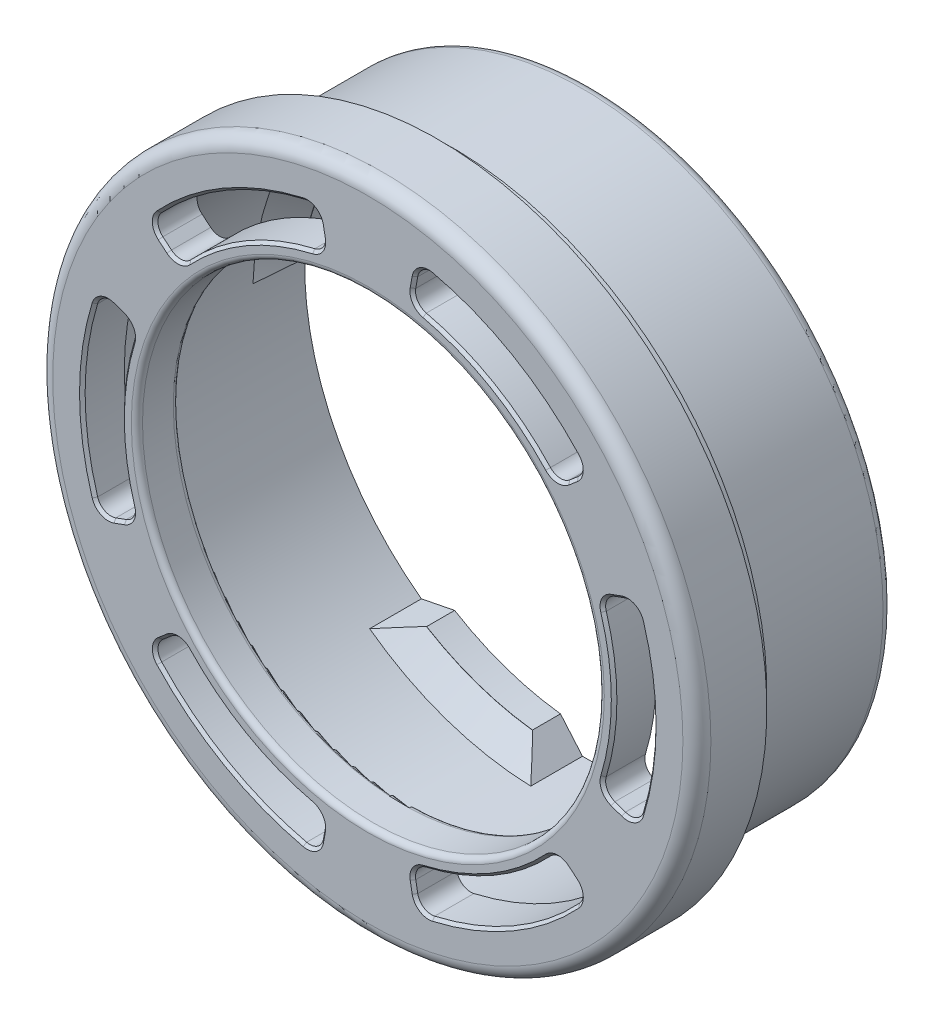
from build123d import *

# Parameters (mm, degrees)
SKETCH_1_R          = 23.515666667
SKETCH_1_R_2        = 16.5
EXTRUDE_1_DEPTH     = 6
SKETCH_2_R          = 23.515666667
SKETCH_2_R_2        = 22.515666667
CUT_EXTRUDE_3_DEPTH = 1
SKETCH_5_R          = 21.515666667
SKETCH_5_R_2        = 20.515666667
EXTRUDE_2_DEPTH     = 10
EXTRUDE_3_DEPTH     = 2
CUT_EXTRUDE_START   = -3
SKETCH_7_R          = 20.515666667
CUT_EXTRUDE_4_DEPTH = 3
CUT_EXTRUDE_5_DEPTH = 3
FILLET_1_R          = 1
FILLET_3_R          = 0.4
FILLET_4_R          = 0.4
FILLET_5_R          = 0.7
CHAMFER_1_SIZE      = 0.2
CHAMFER_START       = -10
CHAMFER_2_DEPTH     = 2
CHAMFER_START_2     = -8
CHAMFER_2_2_DEPTH   = 1.7000001


with BuildPart() as part:
    # 草图1 → 凸台-拉伸1 (new body)
    with BuildSketch(Plane.XY):
        Circle(SKETCH_1_R)
        Circle(SKETCH_1_R_2, mode=Mode.SUBTRACT)
    extrude(amount=EXTRUDE_1_DEPTH)

    # 草图2 → 切除-拉伸3 (cut)
    with BuildSketch(Plane(origin=(0, 0, 0), x_dir=(-1, 0, 0), z_dir=(0, 0, -1))):
        Circle(SKETCH_2_R)
        Circle(SKETCH_2_R_2, mode=Mode.SUBTRACT)
    extrude(amount=-CUT_EXTRUDE_3_DEPTH, mode=Mode.SUBTRACT)

    # 草图5 → 凸台-拉伸2 (add)
    with BuildSketch(Plane(origin=(0, 0, 0), x_dir=(-1, 0, 0), z_dir=(0, 0, -1))):
        with Locations(Location((0, 0, 0), (0, 0, 180))):
            Circle(SKETCH_5_R)
        Circle(SKETCH_5_R_2, mode=Mode.SUBTRACT)
    extrude(amount=EXTRUDE_2_DEPTH)

    # 草图6 → 凸台-拉伸3 (add)
    with BuildSketch(Plane(origin=(0, 0, -10), x_dir=(-1, 0, 0), z_dir=(0, 0, -1))):
        with BuildLine():
            Line((-16.080938673, -9.738758206), (-18.353991972, -11.115339319))
            ThreePointArc((-18.353991972, -11.115339319), (-20.274508623, -7.025958268), (-21.29621173, -2.625101039))
            Line((-21.29621173, -2.625101039), (-18.658778718, -2.299994948))
            ThreePointArc((-18.658778718, -2.299994948), (-17.763608609, -6.155827256), (-16.080938673, -9.738758206))
        make_face()
        with BuildLine():
            Line((-9.738758206, 16.080938673), (-11.115339319, 18.353991972))
            ThreePointArc((-11.115339319, 18.353991972), (-7.025958268, 20.274508623), (-2.625101039, 21.29621173))
            Line((-2.625101039, 21.29621173), (-2.299994948, 18.658778718))
            ThreePointArc((-2.299994948, 18.658778718), (-6.155827256, 17.763608609), (-9.738758206, 16.080938673))
        make_face()
        with BuildLine():
            Line((16.080938673, 9.738758206), (18.353991972, 11.115339319))
            ThreePointArc((18.353991972, 11.115339319), (20.274508623, 7.025958268), (21.29621173, 2.625101039))
            Line((21.29621173, 2.625101039), (18.658778718, 2.299994948))
            ThreePointArc((18.658778718, 2.299994948), (17.763608609, 6.155827256), (16.080938673, 9.738758206))
        make_face()
        with BuildLine():
            Line((9.738758206, -16.080938673), (11.115339319, -18.353991972))
            ThreePointArc((11.115339319, -18.353991972), (7.025958268, -20.274508623), (2.625101039, -21.29621173))
            Line((2.625101039, -21.29621173), (2.299994948, -18.658778718))
            ThreePointArc((2.299994948, -18.658778718), (6.155827256, -17.763608609), (9.738758206, -16.080938673))
        make_face()
    extrude(amount=-EXTRUDE_3_DEPTH)

    # 草图7 → 切除-拉伸4 (cut)
    with BuildSketch(Plane(origin=(0, 0, 0), x_dir=(-1, 0, 0), z_dir=(0, 0, -1)).offset(CUT_EXTRUDE_START)):
        with Locations(Location((0, 0, 0), (0, 0, 187.027178997))):
            Circle(SKETCH_7_R)
    extrude(amount=CUT_EXTRUDE_4_DEPTH, mode=Mode.SUBTRACT)

    # 草图8 → 切除-拉伸5 (cut)
    with BuildSketch(Plane.XY.offset(6)):
        with BuildLine():
            Line((-14.227819147, 11.938557799), (-14.841505651, 12.453501918))
            ThreePointArc((-14.841505651, 12.453501918), (-15.196828628, 13.158103248), (-14.930610724, 13.900966276))
            ThreePointArc((-14.930610724, 13.900966276), (-10.202362304, 17.66555415), (-4.578601263, 19.879547542))
            ThreePointArc((-4.578601263, 19.879547542), (-3.804704862, 19.740583121), (-3.37049634, 19.085075904))
            Line((-3.37049634, 19.085075904), (-3.226328833, 18.297299531))
            ThreePointArc((-3.226328833, 18.297299531), (-3.373933254, 17.568644402), (-3.983648834, 17.143236041))
            ThreePointArc((-3.983648834, 17.143236041), (-8.8, 15.242047107), (-12.854653498, 12.021559111))
            ThreePointArc((-12.854653498, 12.021559111), (-13.524696429, 11.706424064), (-14.227819147, 11.938557799))
        make_face()
        with BuildLine():
            Line((-17.453003912, -6.352373922), (-18.205801852, -6.626369965))
            ThreePointArc((-18.205801852, -6.626369965), (-18.993665992, -6.581788025), (-19.503895294, -5.979805043))
            ThreePointArc((-19.503895294, -5.979805043), (-20.399999818, -0.002727859), (-19.505493819, 5.974588763))
            ThreePointArc((-19.505493819, 5.974588763), (-18.998198899, 6.575320496), (-18.213408736, 6.623602498))
            Line((-18.213408736, 6.623602498), (-17.459090631, 6.354567035))
            ThreePointArc((-17.459090631, 6.354567035), (-16.901858989, 5.862410292), (-16.838302332, 5.121676931))
            ThreePointArc((-16.838302332, 5.121676931), (-17.6, 0), (-16.838302332, -5.121676931))
            ThreePointArc((-16.838302332, -5.121676931), (-16.900408842, -5.859518654), (-17.453003912, -6.352373922))
        make_face()
        with BuildLine():
            Line((3.225184765, 18.290931721), (3.364296201, 19.079871883))
            ThreePointArc((3.364296201, 19.079871883), (3.796837364, 19.739891273), (4.573284571, 19.880771319))
            ThreePointArc((4.573284571, 19.880771319), (10.197637514, 17.668282009), (14.926892555, 13.904958779))
            ThreePointArc((14.926892555, 13.904958779), (15.193494037, 13.165262624), (14.842912396, 12.461473406))
            Line((14.842912396, 12.461473406), (14.232761798, 11.942732496))
            ThreePointArc((14.232761798, 11.942732496), (13.527925735, 11.70623411), (12.854653498, 12.021559111))
            ThreePointArc((12.854653498, 12.021559111), (8.8, 15.242047107), (3.983648834, 17.143236041))
            ThreePointArc((3.983648834, 17.143236041), (3.375712412, 17.565942718), (3.225184765, 18.290931721))
        make_face()
        with BuildLine():
            Line((17.453003912, 6.352373922), (18.205801852, 6.626369965))
            ThreePointArc((18.205801852, 6.626369965), (18.993665992, 6.581788025), (19.503895294, 5.979805043))
            ThreePointArc((19.503895294, 5.979805043), (20.399999818, 0.002727859), (19.505493819, -5.974588763))
            ThreePointArc((19.505493819, -5.974588763), (18.998198899, -6.575320496), (18.213408736, -6.623602498))
            Line((18.213408736, -6.623602498), (17.459090631, -6.354567035))
            ThreePointArc((17.459090631, -6.354567035), (16.901858989, -5.862410292), (16.838302332, -5.121676931))
            ThreePointArc((16.838302332, -5.121676931), (17.6, 0), (16.838302332, 5.121676931))
            ThreePointArc((16.838302332, 5.121676931), (16.900408842, 5.859518654), (17.453003912, 6.352373922))
        make_face()
        with BuildLine():
            Line((14.227819147, -11.938557799), (14.841505651, -12.453501918))
            ThreePointArc((14.841505651, -12.453501918), (15.196828628, -13.158103248), (14.930610724, -13.900966276))
            ThreePointArc((14.930610724, -13.900966276), (10.202362304, -17.66555415), (4.578601263, -19.879547542))
            ThreePointArc((4.578601263, -19.879547542), (3.804704862, -19.740583121), (3.37049634, -19.085075904))
            Line((3.37049634, -19.085075904), (3.226328833, -18.297299531))
            ThreePointArc((3.226328833, -18.297299531), (3.373933254, -17.568644402), (3.983648834, -17.143236041))
            ThreePointArc((3.983648834, -17.143236041), (8.8, -15.242047107), (12.854653498, -12.021559111))
            ThreePointArc((12.854653498, -12.021559111), (13.524696429, -11.706424064), (14.227819147, -11.938557799))
        make_face()
        with BuildLine():
            Line((-3.225184765, -18.290931721), (-3.364296201, -19.079871883))
            ThreePointArc((-3.364296201, -19.079871883), (-3.796837364, -19.739891273), (-4.573284571, -19.880771319))
            ThreePointArc((-4.573284571, -19.880771319), (-10.197637514, -17.668282009), (-14.926892555, -13.904958779))
            ThreePointArc((-14.926892555, -13.904958779), (-15.193494037, -13.165262624), (-14.842912396, -12.461473406))
            Line((-14.842912396, -12.461473406), (-14.232761798, -11.942732496))
            ThreePointArc((-14.232761798, -11.942732496), (-13.527925735, -11.70623411), (-12.854653498, -12.021559111))
            ThreePointArc((-12.854653498, -12.021559111), (-8.8, -15.242047107), (-3.983648834, -17.143236041))
            ThreePointArc((-3.983648834, -17.143236041), (-3.375712412, -17.565942718), (-3.225184765, -18.290931721))
        make_face()
    extrude(amount=-CUT_EXTRUDE_5_DEPTH, mode=Mode.SUBTRACT)

    # 圆角1
    fillet_1_edges = [part.edges().sort_by_distance(p)[0] for p in [
        (-23.515666667, 0, 6),
    ]]
    fillet(fillet_1_edges, radius=FILLET_1_R)

    # 圆角3
    fillet_3_edges = [part.edges().sort_by_distance(p)[0] for p in [
        (-16.5, 0, 3),
    ]]
    fillet(fillet_3_edges, radius=FILLET_3_R)

    # 圆角4
    fillet_4_edges = [part.edges().sort_by_distance(p)[0] for p in [
        (-16.5, 0, 6),
    ]]
    fillet(fillet_4_edges, radius=FILLET_4_R)

    # 圆角5
    fillet_5_edges = [part.edges().sort_by_distance(p)[0] for p in [
        (-21.515666667, 0, -10),
    ]]
    fillet(fillet_5_edges, radius=FILLET_5_R)

    # 倒角1
    chamfer_1_edges = [part.edges().sort_by_distance(p)[0] for p in [
        (-16.900408842, -5.859518654, 6),
        (-17.6, 0, 6),
        (-16.901858989, 5.862410292, 6),
        (-17.836249684, 6.489084766, 6),
        (-18.998198899, 6.575320496, 6),
        (-20.399999818, -0.002727859, 6),
        (-18.993665992, -6.581788025, 6),
        (-17.829402882, -6.489371944, 6),
        (-3.375712412, -17.565942718, 6),
        (-8.8, -15.242047107, 6),
        (-13.527925735, -11.70623411, 6),
        (-14.537837097, -12.202102951, 6),
        (-15.193494037, -13.165262624, 6),
        (-10.197637514, -17.668282009, 6),
        (-3.796837364, -19.739891273, 6),
        (-3.294740483, -18.685401802, 6),
        (13.524696429, -11.706424064, 6),
        (8.8, -15.242047107, 6),
        (3.373933254, -17.568644402, 6),
        (3.298412587, -18.691187717, 6),
        (3.804704862, -19.740583121, 6),
        (10.202362304, -17.66555415, 6),
        (15.196828628, -13.158103248, 6),
        (14.534662399, -12.196029858, 6),
        (16.900408842, 5.859518654, 6),
        (17.6, 0, 6),
        (16.901858989, -5.862410292, 6),
        (17.836249684, -6.489084766, 6),
        (18.998198899, -6.575320496, 6),
        (20.399999818, 0.002727859, 6),
        (18.993665992, 6.581788025, 6),
        (17.829402882, 6.489371944, 6),
        (3.375712412, 17.565942718, 6),
        (8.8, 15.242047107, 6),
        (13.527925735, 11.70623411, 6),
        (14.537837097, 12.202102951, 6),
        (15.193494037, 13.165262624, 6),
        (10.197637514, 17.668282009, 6),
        (3.796837364, 19.739891273, 6),
        (3.294740483, 18.685401802, 6),
        (-13.524696429, 11.706424064, 6),
        (-8.8, 15.242047107, 6),
        (-3.373933254, 17.568644402, 6),
        (-3.298412587, 18.691187717, 6),
        (-3.804704862, 19.740583121, 6),
        (-10.202362304, 17.66555415, 6),
        (-15.196828628, 13.158103248, 6),
        (-14.534662399, 12.196029858, 6),
    ]]
    chamfer(chamfer_1_edges, length=CHAMFER_1_SIZE)

    # 倒角2: read off the stored shape, not the designer's step
    # 倒角2 outline → 倒角2 (add)
    with BuildSketch(Plane.XY.offset(CHAMFER_START)):
        with BuildLine():
            ThreePointArc((-2.509889878, -20.361557691), (-1.586544458, -20.454228303), (-0.659952936, -20.505049157))
            Line((-0.659952936, -20.505049157), (-2.233513741, -18.666853414))
            ThreePointArc((-2.233513741, -18.666853414), (-2.26675794, -18.662845669), (-2.299994948, -18.658778718))
            Line((-2.299994948, -18.658778718), (-2.509889878, -20.361557691))
        make_face()
        with BuildLine():
            Line((16.046145076, -9.795980206), (16.516496854, -12.16954849))
            ThreePointArc((16.516496854, -12.16954849), (17.049924114, -11.410200108), (17.548466889, -10.627506228))
            Line((17.548466889, -10.627506228), (16.080938673, -9.738758206))
            ThreePointArc((16.080938673, -9.738758206), (16.063567354, -9.767384699), (16.046145076, -9.795980206))
        make_face()
        with BuildLine():
            ThreePointArc((-12.16954849, -16.516496854), (-11.410200108, -17.049924114), (-10.627506228, -17.548466889))
            Line((-10.627506228, -17.548466889), (-9.738758206, -16.080938673))
            ThreePointArc((-9.738758206, -16.080938673), (-9.767384699, -16.063567354), (-9.795980206, -16.046145076))
            Line((-9.795980206, -16.046145076), (-12.16954849, -16.516496854))
        make_face()
        with BuildLine():
            Line((18.658778718, -2.299994948), (20.361557691, -2.509889878))
            ThreePointArc((20.361557691, -2.509889878), (20.454228303, -1.586544458), (20.505049157, -0.659952936))
            Line((20.505049157, -0.659952936), (18.666853414, -2.233513741))
            ThreePointArc((18.666853414, -2.233513741), (18.662845669, -2.26675794), (18.658778718, -2.299994948))
        make_face()
        with BuildLine():
            ThreePointArc((-20.361557691, 2.509889878), (-20.454228303, 1.586544458), (-20.505049157, 0.659952936))
            Line((-20.505049157, 0.659952936), (-18.666853414, 2.233513741))
            ThreePointArc((-18.666853414, 2.233513741), (-18.662845669, 2.26675794), (-18.658778718, 2.299994948))
            Line((-18.658778718, 2.299994948), (-20.361557691, 2.509889878))
        make_face()
        with BuildLine():
            ThreePointArc((-16.516496854, 12.16954849), (-17.049924114, 11.410200108), (-17.548466889, 10.627506228))
            Line((-17.548466889, 10.627506228), (-16.080938673, 9.738758206))
            ThreePointArc((-16.080938673, 9.738758206), (-16.063567354, 9.767384699), (-16.046145076, 9.795980206))
            Line((-16.046145076, 9.795980206), (-16.516496854, 12.16954849))
        make_face()
        with BuildLine():
            Line((9.795980206, 16.046145076), (12.16954849, 16.516496854))
            ThreePointArc((12.16954849, 16.516496854), (11.410200108, 17.049924114), (10.627506228, 17.548466889))
            Line((10.627506228, 17.548466889), (9.738758206, 16.080938673))
            ThreePointArc((9.738758206, 16.080938673), (9.767384699, 16.063567354), (9.795980206, 16.046145076))
        make_face()
        with BuildLine():
            ThreePointArc((2.509889878, 20.361557691), (1.586544458, 20.454228303), (0.659952936, 20.505049157))
            Line((0.659952936, 20.505049157), (2.233513741, 18.666853414))
            ThreePointArc((2.233513741, 18.666853414), (2.26675794, 18.662845669), (2.299994948, 18.658778718))
            Line((2.299994948, 18.658778718), (2.509889878, 20.361557691))
        make_face()
    extrude(amount=CHAMFER_2_DEPTH)

    # Chamfer 2 2 outline → Chamfer 2 2 (add)
    with BuildSketch(Plane.XY.offset(CHAMFER_START_2)):
        with BuildLine():
            ThreePointArc((-12.16954849, -16.516496854), (-6.717601066, -19.384695373), (-0.659952936, -20.505049157))
            Line((-0.659952936, -20.505049157), (-2.233513741, -18.666853414))
            ThreePointArc((-2.233513741, -18.666853414), (-6.155827256, -17.763608609), (-9.795980206, -16.046145076))
            Line((-9.795980206, -16.046145076), (-12.16954849, -16.516496854))
        make_face()
        with BuildLine():
            Line((16.046145076, -9.795980206), (16.516496854, -12.16954849))
            ThreePointArc((16.516496854, -12.16954849), (19.384695373, -6.717601066), (20.505049157, -0.659952936))
            Line((20.505049157, -0.659952936), (18.666853414, -2.233513741))
            ThreePointArc((18.666853414, -2.233513741), (17.763608609, -6.155827256), (16.046145076, -9.795980206))
        make_face()
        with BuildLine():
            ThreePointArc((-16.516496854, 12.16954849), (-19.384695373, 6.717601066), (-20.505049157, 0.659952936))
            Line((-20.505049157, 0.659952936), (-18.666853414, 2.233513741))
            ThreePointArc((-18.666853414, 2.233513741), (-17.763608609, 6.155827256), (-16.046145076, 9.795980206))
            Line((-16.046145076, 9.795980206), (-16.516496854, 12.16954849))
        make_face()
        with BuildLine():
            ThreePointArc((12.16954849, 16.516496854), (6.717601066, 19.384695373), (0.659952936, 20.505049157))
            Line((0.659952936, 20.505049157), (2.233513741, 18.666853414))
            ThreePointArc((2.233513741, 18.666853414), (6.155827256, 17.763608609), (9.795980206, 16.046145076))
            Line((9.795980206, 16.046145076), (12.16954849, 16.516496854))
        make_face()
    extrude(amount=CHAMFER_2_2_DEPTH)

    # Chamfer 2 3 outline → Chamfer 2 3 (revolve, cut)
    with BuildSketch(Plane.XZ):
        Polygon((18.800000001, -6.2999999), (18.800000001, -8), (18.815666667, -8), (20.515666667, -6.3), align=None)
    revolve(axis=Axis((0, 0, 0), (0, 0, 1)), mode=Mode.SUBTRACT)


solid = part.part
